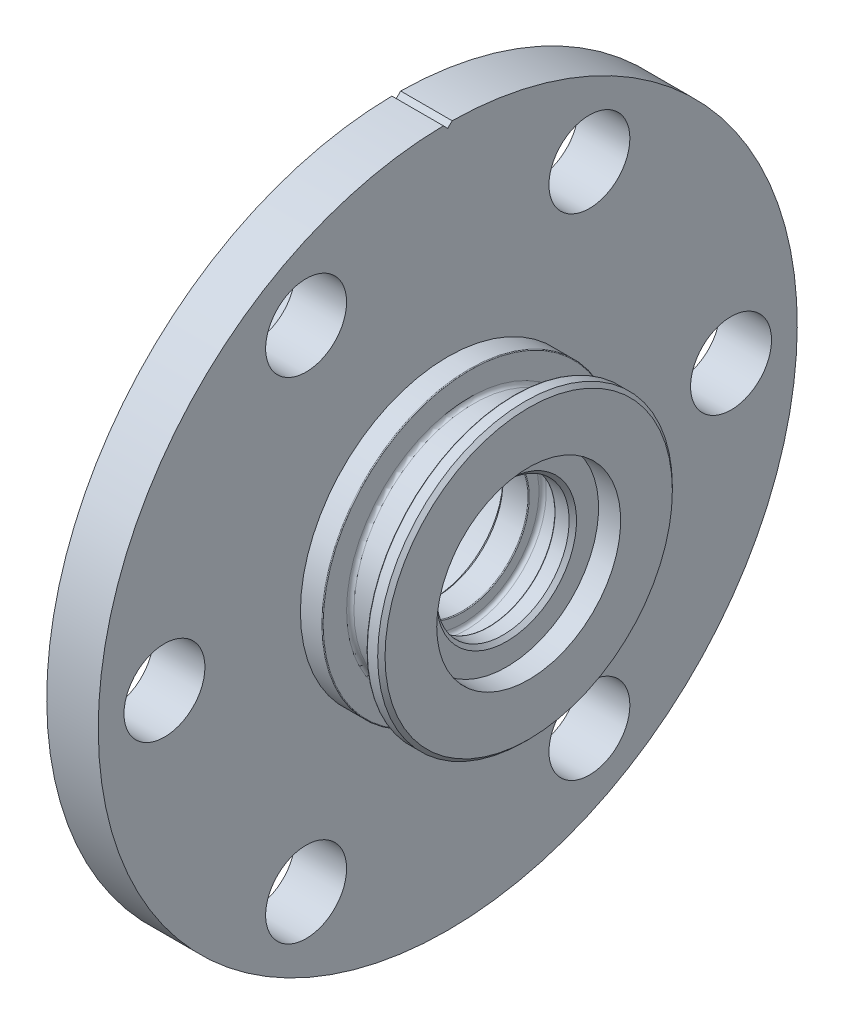
from build123d import *

# Parameters (mm, degrees)
SKETCH_2_R               = 5.5
CUT_EXTRUDE_1_DEPTH      = 70.810457669
PATTERN_CIRCULAR_1_COUNT = 6
CUT_EXTRUDE_2_DEPTH      = 70.810457669
CUT_EXTRUDE_3_DEPTH      = 4
CUT_EXTRUDE_4_DEPTH      = 3
CUT_EXTRUDE_5_DEPTH      = 0.5
CUT_EXTRUDE_6_DEPTH      = 0.5


with BuildPart() as part:
    # Эскиз1 → Повернуть1 (revolve)
    with BuildSketch(Plane.XY):
        with BuildLine():
            Line((0, 15), (17, 15))
            Line((17, 15), (17, 9.5))
            Line((17, 9.5), (17.5, 9))
            Line((17.5, 9), (20.9, 9))
            ThreePointArc((20.9, 9), (20.970710678, 9.029289322), (21, 9.1))
            Line((21, 9.1), (21, 10.4))
            ThreePointArc((21, 10.4), (21.146446609, 10.753553391), (21.5, 10.9))
            Line((21.5, 10.9), (24, 10.9))
            ThreePointArc((24, 10.9), (24.353553391, 10.753553391), (24.5, 10.4))
            Line((24.5, 10.4), (24.5, 9.1))
            ThreePointArc((24.5, 9.1), (24.529289322, 9.029289322), (24.6, 9))
            Line((24.6, 9), (26.5, 9))
            Line((26.5, 9), (27, 9.5))
            Line((27, 9.5), (27, 12.5))
            Line((27, 12.5), (30, 12.5))
            Line((30, 12.5), (30, 19.525))
            Line((30, 19.525), (29.5, 20.025))
            Line((29.5, 20.025), (28.1, 20.025))
            ThreePointArc((28.1, 20.025), (28.029289322, 19.995710678), (28, 19.925))
            Line((28, 19.925), (28, 16.75))
            ThreePointArc((28, 16.75), (27.853553391, 16.396446609), (27.5, 16.25))
            Line((27.5, 16.25), (22.5, 16.25))
            ThreePointArc((22.5, 16.25), (22.146446609, 16.396446609), (22, 16.75))
            Line((22, 16.75), (22, 19.925))
            ThreePointArc((22, 19.925), (21.970710678, 19.995710678), (21.9, 20.025))
            Line((21.9, 20.025), (19, 20.025))
            Line((19, 20.025), (19, 47.5))
            Line((19, 47.5), (12, 47.5))
            Line((12, 47.5), (12, 25))
            Line((12, 25), (0, 25))
            Line((0, 25), (0, 15))
        make_face()
    revolve(axis=Axis((0, 0, 0), (1, 0, 0)))

    # Эскиз2 → Вырез-Вытянуть1 (cut, through all)
    with BuildSketch(Plane(origin=(19, 0, 0), x_dir=(0, 0, -1), z_dir=(1, 0, 0))):
        with Locations((38.5, 0)):
            Circle(SKETCH_2_R)
    cut_extrude_1 = extrude(amount=-CUT_EXTRUDE_1_DEPTH, mode=Mode.SUBTRACT)

    # Круговой массив1: Вырез-Вытянуть1 ×6 about axis
    pattern_circular_1_axis = Axis((0, 0, 0), (-1, 0, 0))
    for i in range(1, PATTERN_CIRCULAR_1_COUNT):
        add(cut_extrude_1.rotate(pattern_circular_1_axis, i * 360 / PATTERN_CIRCULAR_1_COUNT), mode=Mode.SUBTRACT)

    # Эскиз3 → Вырез-Вытянуть2 (cut, through all)
    with BuildSketch(Plane(origin=(19, 0, 0), x_dir=(0, 0, -1), z_dir=(1, 0, 0))):
        with BuildLine():
            Line((-0.596257505, 47.496257505), (0, 46.9))
            Line((0, 46.9), (0.596257505, 47.496257505))
            ThreePointArc((0.596257505, 47.496257505), (0, 47.5), (-0.596257505, 47.496257505))
        make_face()
    extrude(amount=-CUT_EXTRUDE_2_DEPTH, mode=Mode.SUBTRACT)

    # Эскиз4 → Вырез-Вытянуть3 (cut)
    with BuildSketch(Plane.ZY):
        with BuildLine():
            Line((-22.449944321, -11), (-10.198039027, -11))
            ThreePointArc((-10.198039027, -11), (-12.990381057, 7.5), (4.427259928, 14.331760866))
            Line((4.427259928, 14.331760866), (-1.698692719, 24.942222095))
            ThreePointArc((-1.698692719, 24.942222095), (-21.650635095, 12.5), (-22.449944321, -11))
        make_face()
    extrude(amount=-CUT_EXTRUDE_3_DEPTH, mode=Mode.SUBTRACT)

    # Эскиз5 → Вырез-Вытянуть4 (cut)
    with BuildSketch(Plane.ZY.offset(-4)):
        with BuildLine():
            Line((-24.787849846, -3.25), (-14.643684646, -3.25))
            ThreePointArc((-14.643684646, -3.25), (-15, 0), (-14.643684646, 3.25))
            Line((-14.643684646, 3.25), (-24.787849846, 3.25))
            ThreePointArc((-24.787849846, 3.25), (-25, 0), (-24.787849846, -3.25))
        make_face()
        with BuildLine():
            Line((-15.208507485, 19.841907672), (-10.136424885, 11.056802908))
            ThreePointArc((-10.136424885, 11.056802908), (-7.5, 12.990381057), (-4.507259761, 14.306802908))
            Line((-4.507259761, 14.306802908), (-9.579342361, 23.091907672))
            ThreePointArc((-9.579342361, 23.091907672), (-12.5, 21.650635095), (-15.208507485, 19.841907672))
        make_face()
    extrude(amount=-CUT_EXTRUDE_4_DEPTH, mode=Mode.SUBTRACT)

    # Эскиз6 → Вырез-Вытянуть5 (cut)
    # profile 1 of 4: a face of its own
    with BuildSketch(Plane.ZY.offset(-12)):
        with BuildLine():
            Line((-0.180554406, 39.477018573), (0.357907132, 42.078180432))
            add(Edge.make_bspline(
                [(0.357907132, 42.078180432), (0.327144435, 42.055049142), (0.264132599, 42.007668867), (0.161224433, 41.943863239), (0.05006028, 41.882293935), (-0.070751591, 41.825598544), (-0.199878164, 41.770132642), (-0.338940831, 41.720698495), (-0.486111877, 41.672171644), (-0.588223671, 41.644849669), (-0.640490304, 41.630864726)],
                knots=[0, 0, 0, 0, 0.838359274, 1.717227777, 2.63582179, 3.606248445, 4.624055798, 5.697042507, 6.821215173, 8, 8, 8, 8], degree=3))
            Line((-0.640490304, 41.630864726), (-0.560562419, 41.989839085))
            add(Edge.make_bspline(
                [(-0.560562419, 41.989839085), (-0.507209173, 42.013756687), (-0.399270795, 42.06214413), (-0.241266586, 42.147063614), (-0.08349029, 42.240751127), (0.044089891, 42.327913735), (0.143742968, 42.399707853), (0.214231776, 42.451889885), (0.279749679, 42.502534023), (0.340126411, 42.551556729), (0.395379775, 42.599197515), (0.445871232, 42.644779087), (0.491867065, 42.68810806), (0.519756203, 42.717480305), (0.533187581, 42.731625944)],
                knots=[0, 0, 0, 0, 1.583313545, 3.203184633, 4.855583746, 6.551690609, 7.386215473, 8.182603945, 8.927160296, 9.629134756, 10.288998473, 10.903058912, 11.471714409, 12, 12, 12, 12], degree=3))
            add(Edge.make_bspline(
                [(0.533187581, 42.731625944), (0.54862987, 42.749182437), (0.580285751, 42.785172326), (0.623996935, 42.844365542), (0.667114487, 42.908431815), (0.69396942, 42.953740133), (0.707766908, 42.977018573)],
                knots=[0, 0, 0, 0, 0.929584414, 1.905599249, 2.923941894, 4, 4, 4, 4], degree=3))
            Line((0.707766908, 42.977018573), (0.949653927, 42.977018573))
            Line((0.949653927, 42.977018573), (0.230302966, 39.477018573))
            Line((0.230302966, 39.477018573), (-0.180554406, 39.477018573))
        make_face()
    # profile 2 of 4: a face of its own
    with BuildSketch(Plane.ZY.offset(-12)):
        with BuildLine():
            add(Edge.make_bspline(
                [(33.658708126, 20.6558349), (33.70781934, 20.671067075), (33.80244326, 20.700415322), (33.942982258, 20.731002115), (34.07527117, 20.751407215), (34.201975519, 20.759193075), (34.325829957, 20.756482967), (34.450405191, 20.742465624), (34.577434975, 20.720198397), (34.686367299, 20.69285953), (34.780722389, 20.663773108), (34.864852683, 20.636380514), (34.961567209, 20.603287896), (35.071075572, 20.564842528), (35.192886696, 20.51968141), (35.327331683, 20.469365122), (35.474353949, 20.413081675), (35.576304887, 20.373122717), (35.629561491, 20.352249163)],
                knots=[0, 0, 0, 0, 1.204779305, 2.321281203, 3.367971213, 4.339492292, 5.292959753, 6.268180703, 7.275121332, 8.31414202, 8.898160544, 9.589397699, 10.388039475, 11.294205731, 12.309856272, 13.43320494, 14.659170863, 16, 16, 16, 16], degree=3))
            add(Edge.make_bspline(
                [(35.629561491, 20.352249163), (35.661761364, 20.339493414), (35.723665541, 20.314970518), (35.813761481, 20.281774786), (35.896133543, 20.250400904), (35.971850624, 20.224145809), (36.040182159, 20.20055545), (36.101514827, 20.18121014), (36.155643291, 20.164714375), (36.189497352, 20.15583998), (36.205182485, 20.151728329)],
                knots=[0, 0, 0, 0, 1.362870858, 2.620115953, 3.77833347, 4.831281057, 5.773586764, 6.622888737, 7.361962113, 8, 8, 8, 8], degree=3))
            add(Edge.make_bspline(
                [(36.205182485, 20.151728329), (36.245486949, 20.142398003), (36.323263041, 20.124393142), (36.438228858, 20.10933454), (36.546162786, 20.10259052), (36.615578372, 20.106890191), (36.648992581, 20.1089599)],
                knots=[0, 0, 0, 0, 1.107911723, 2.137952887, 3.103676364, 4, 4, 4, 4], degree=3))
            add(Edge.make_bspline(
                [(36.648992581, 20.1089599), (36.671079966, 20.111890814), (36.715350813, 20.117765392), (36.779870162, 20.137045291), (36.843957367, 20.161117958), (36.884339566, 20.183234895), (36.904902036, 20.194496759)],
                knots=[0, 0, 0, 0, 0.982488777, 1.969251264, 2.965950105, 4, 4, 4, 4], degree=3))
            add(Edge.make_bspline(
                [(36.904902036, 20.194496759), (36.921735941, 20.204661743), (36.954834259, 20.224647828), (36.99979837, 20.260353596), (37.041103649, 20.298705349), (37.07621987, 20.341877457), (37.108733234, 20.386920884), (37.1352222, 20.436298417), (37.15683223, 20.489285068), (37.174483505, 20.544773791), (37.185886039, 20.601957436), (37.193484681, 20.659098713), (37.194207645, 20.71606109), (37.188108549, 20.77231293), (37.178045578, 20.828168698), (37.160737988, 20.882971738), (37.138286262, 20.937461246), (37.119307678, 20.972435148), (37.1096296, 20.990269996)],
                knots=[0, 0, 0, 0, 1.029422278, 2.024019106, 3.002884985, 3.976604764, 4.934720418, 5.910132956, 6.903975558, 7.930406914, 8.955961227, 9.955446647, 10.947476769, 11.932071302, 12.916818143, 13.916228535, 14.937386339, 16, 16, 16, 16], degree=3))
            add(Edge.make_bspline(
                [(37.1096296, 20.990269996), (37.099258991, 21.007585275), (37.078789479, 21.041762181), (37.041774911, 21.088124327), (37.001426387, 21.130020511), (36.959096922, 21.169706288), (36.910604159, 21.201808729), (36.860157682, 21.231772525), (36.805809736, 21.257263669), (36.747471835, 21.277315328), (36.685664583, 21.293159702), (36.619805051, 21.301878929), (36.55015746, 21.30548299), (36.476499016, 21.302493311), (36.399036321, 21.292936928), (36.317504887, 21.278253712), (36.232125034, 21.257098872), (36.174481313, 21.239228575), (36.14488601, 21.23005365)],
                knots=[0, 0, 0, 0, 0.890791895, 1.7582455, 2.61263812, 3.46058193, 4.313975991, 5.174521437, 6.052053172, 6.959735025, 7.89619894, 8.865656837, 9.889025904, 10.973821993, 12.117354432, 13.334393261, 14.63143049, 16, 16, 16, 16], degree=3))
            Line((36.14488601, 21.23005365), (35.987834728, 21.625486342))
            add(Edge.make_bspline(
                [(35.987834728, 21.625486342), (36.023377912, 21.63942523), (36.09309944, 21.66676776), (36.199330193, 21.696511893), (36.303792639, 21.717931387), (36.406527864, 21.730339642), (36.507985583, 21.731403691), (36.60748786, 21.723810365), (36.705718407, 21.707042489), (36.801368025, 21.680222967), (36.894132268, 21.645205344), (36.982655084, 21.601921046), (37.065716279, 21.549507597), (37.143823416, 21.489633923), (37.217501383, 21.421976991), (37.285105325, 21.345109974), (37.348750098, 21.260905178), (37.385911661, 21.200010463), (37.404801876, 21.169056054)],
                knots=[0, 0, 0, 0, 1.115855542, 2.188862788, 3.220910342, 4.232248558, 5.209649385, 6.183027772, 7.147052098, 8.118701484, 9.083379673, 10.04310653, 10.995014708, 11.950498094, 12.917787316, 13.91498675, 14.940132114, 16, 16, 16, 16], degree=3))
            add(Edge.make_bspline(
                [(37.404801876, 21.169056054), (37.427786379, 21.12630376), (37.472887094, 21.042414237), (37.522171415, 20.91024722), (37.553883536, 20.776429714), (37.569586568, 20.642495513), (37.567887374, 20.510617787), (37.54787882, 20.383741948), (37.507941205, 20.263618397), (37.450101935, 20.152206611), (37.379608582, 20.050322016), (37.298935448, 19.959891575), (37.209853823, 19.880579501), (37.142998173, 19.838831404), (37.1096296, 19.817994355)],
                knots=[0, 0, 0, 0, 1.127989899, 2.21336743, 3.269451819, 4.31995369, 5.342013454, 6.327707805, 7.295477983, 8.272773045, 9.237791438, 10.169519232, 11.086381901, 12, 12, 12, 12], degree=3))
            add(Edge.make_bspline(
                [(37.1096296, 19.817994355), (37.084399482, 19.804171889), (37.033876791, 19.776492739), (36.953372801, 19.743888494), (36.869977682, 19.717588936), (36.783206349, 19.699917522), (36.693769166, 19.687330493), (36.60088303, 19.683991325), (36.504760752, 19.68528067), (36.440018138, 19.692851549), (36.407105562, 19.696700284)],
                knots=[0, 0, 0, 0, 0.950163752, 1.902679592, 2.865321406, 3.836448888, 4.826229905, 5.846936954, 6.90546815, 8, 8, 8, 8], degree=3))
            add(Edge.make_bspline(
                [(36.407105562, 19.696700284), (36.395873699, 19.698492607), (36.371695697, 19.702350808), (36.333157753, 19.710277491), (36.289590333, 19.719967898), (36.241214034, 19.732702955), (36.188053967, 19.748352986), (36.129525039, 19.765796681), (36.066272916, 19.786174649), (35.997916154, 19.808517471), (35.925176328, 19.834049445), (35.847168322, 19.861115332), (35.764449991, 19.891721128), (35.676300273, 19.923459173), (35.583595885, 19.958742559), (35.486106708, 19.996886688), (35.383367174, 20.03648651), (35.313338862, 20.064045298), (35.27759835, 20.078110541)],
                knots=[0, 0, 0, 0, 0.457246047, 0.984279848, 1.581521093, 2.251567047, 2.995007651, 3.809514434, 4.706951792, 5.666714152, 6.700824875, 7.806324329, 8.986417404, 10.246789651, 11.573106774, 12.974297352, 14.455765103, 16, 16, 16, 16], degree=3))
            add(Edge.make_bspline(
                [(35.27759835, 20.078110541), (35.247004644, 20.090086269), (35.187551502, 20.113358855), (35.100608509, 20.146315664), (35.018568104, 20.176450836), (34.941581192, 20.203976877), (34.86957926, 20.227831399), (34.802319425, 20.248050978), (34.740580941, 20.26653598), (34.665876399, 20.285748047), (34.579258602, 20.304721248), (34.48090738, 20.322206939), (34.389008558, 20.33176024), (34.329934178, 20.332340027), (34.301636812, 20.332617752)],
                knots=[0, 0, 0, 0, 1.165771828, 2.265459344, 3.299162083, 4.266999938, 5.166485247, 5.990184484, 6.759087513, 7.453007125, 8.726665259, 9.904584845, 10.996269963, 12, 12, 12, 12], degree=3))
            Line((34.301636812, 20.332617752), (35.081985369, 18.981556054))
            Line((35.081985369, 18.981556054), (34.697770626, 18.856055252))
            Line((34.697770626, 18.856055252), (33.658708126, 20.6558349))
        make_face()
    # profile 3 of 4: a face of its own
    with BuildSketch(Plane.ZY.offset(-12)):
        with BuildLine():
            Line((-36.969019669, -20.099422896), (-36.713811335, -20.435260235))
            add(Edge.make_bspline(
                [(-36.713811335, -20.435260235), (-36.737143841, -20.453717847), (-36.782413341, -20.489529127), (-36.844958157, -20.54546256), (-36.899578254, -20.601810945), (-36.948054085, -20.657059859), (-36.98794823, -20.713129227), (-37.020354994, -20.768836515), (-37.046529998, -20.823899548), (-37.063597763, -20.87953353), (-37.075347174, -20.934914308), (-37.079922645, -20.990681664), (-37.079574753, -21.046629907), (-37.072114752, -21.102729203), (-37.059439698, -21.159048394), (-37.041058785, -21.215782548), (-37.017394953, -21.273051449), (-36.99697643, -21.309747152), (-36.986547713, -21.328489402)],
                knots=[0, 0, 0, 0, 1.369991066, 2.658043362, 3.860650297, 4.982569779, 6.039844813, 7.023792536, 7.948437492, 8.840301675, 9.697322654, 10.550957523, 11.412091524, 12.269180089, 13.15177349, 14.067416344, 15.012937116, 16, 16, 16, 16], degree=3))
            add(Edge.make_bspline(
                [(-36.986547713, -21.328489402), (-36.973008483, -21.350792493), (-36.946158399, -21.395022468), (-36.897781903, -21.454888498), (-36.846367679, -21.510304627), (-36.788466143, -21.55802604), (-36.727085393, -21.601010978), (-36.660292634, -21.637763538), (-36.588921211, -21.668527595), (-36.513454694, -21.69269042), (-36.436840704, -21.710848274), (-36.360777544, -21.721699502), (-36.286582555, -21.724112409), (-36.214213479, -21.72117743), (-36.143412888, -21.709777646), (-36.07468452, -21.690613603), (-36.007536573, -21.664879048), (-35.965258583, -21.642125172), (-35.943979604, -21.630672896)],
                knots=[0, 0, 0, 0, 1.041625132, 2.065680238, 3.06994913, 4.05779477, 5.057928611, 6.061328383, 7.098925301, 8.159352125, 9.224212466, 10.24267195, 11.224138038, 12.187344575, 13.133276971, 14.082753663, 15.035028809, 16, 16, 16, 16], degree=3))
            add(Edge.make_bspline(
                [(-35.943979604, -21.630672896), (-35.925956669, -21.619838539), (-35.890647438, -21.598612651), (-35.843032099, -21.560813255), (-35.799490773, -21.520810773), (-35.761811798, -21.476654884), (-35.72940445, -21.429278247), (-35.701578583, -21.378942196), (-35.67928544, -21.32508443), (-35.662548126, -21.268185278), (-35.651247093, -21.209499617), (-35.646349981, -21.149794192), (-35.647815346, -21.08940314), (-35.655607419, -21.028581453), (-35.669593863, -20.966926242), (-35.691325859, -20.905370112), (-35.71754521, -20.8423224), (-35.740231038, -20.801738726), (-35.751872233, -20.78091328)],
                knots=[0, 0, 0, 0, 1.029331314, 2.016591381, 2.972608994, 3.92277935, 4.853428351, 5.781043041, 6.735894067, 7.703296896, 8.682488308, 9.659132008, 10.632750058, 11.636932618, 12.659169198, 13.72381926, 14.831981622, 16, 16, 16, 16], degree=3))
            add(Edge.make_bspline(
                [(-35.751872233, -20.78091328), (-35.755591517, -20.774824341), (-35.764515348, -20.760214901), (-35.780910378, -20.734759243), (-35.802300771, -20.702034845), (-35.819093325, -20.678256893), (-35.828294508, -20.665228184)],
                knots=[0, 0, 0, 0, 0.617384292, 1.481315283, 2.619931199, 4, 4, 4, 4], degree=3))
            Line((-35.828294508, -20.665228184), (-35.48123922, -20.549543088))
            add(Edge.make_bspline(
                [(-35.48123922, -20.549543088), (-35.473352026, -20.56837862), (-35.457951102, -20.605157811), (-35.439203716, -20.64034761), (-35.430057329, -20.657515844)],
                knots=[0, 0, 0, 0, 1.024249383, 2, 2, 2, 2], degree=3))
            add(Edge.make_bspline(
                [(-35.430057329, -20.657515844), (-35.414801662, -20.683021081), (-35.385019885, -20.732811841), (-35.334787655, -20.801124244), (-35.283982823, -20.863593267), (-35.229820116, -20.917700431), (-35.173373871, -20.964262254), (-35.115173994, -21.003986563), (-35.054330966, -21.035605986), (-34.992134721, -21.060387055), (-34.928897413, -21.076835761), (-34.866262569, -21.087561168), (-34.804236352, -21.091998561), (-34.743046674, -21.089251093), (-34.682907328, -21.079163264), (-34.623785684, -21.062815083), (-34.565143894, -21.040763475), (-34.528193851, -21.020460434), (-34.509484412, -21.010180107)],
                knots=[0, 0, 0, 0, 1.287028092, 2.512507782, 3.670349145, 4.773073973, 5.823309793, 6.837229631, 7.820130982, 8.788580591, 9.731818402, 10.645791963, 11.538997133, 12.420937503, 13.29329128, 14.17523165, 15.07603919, 16, 16, 16, 16], degree=3))
            add(Edge.make_bspline(
                [(-34.509484412, -21.010180107), (-34.492644717, -21.00002244), (-34.459535014, -20.98005074), (-34.414778977, -20.944340429), (-34.373538509, -20.906736652), (-34.337931698, -20.864883764), (-34.305897341, -20.820672341), (-34.279137708, -20.772644407), (-34.257644133, -20.721216948), (-34.240110536, -20.667548192), (-34.227616901, -20.612650529), (-34.220140925, -20.557482836), (-34.219908034, -20.502950479), (-34.223878254, -20.448923744), (-34.233778207, -20.395569247), (-34.249369495, -20.342761664), (-34.270339374, -20.290520451), (-34.288518711, -20.257239909), (-34.29774563, -20.240348376)],
                knots=[0, 0, 0, 0, 1.059362376, 2.082886426, 3.081592175, 4.064427905, 5.040127438, 6.021831334, 7.021331915, 8.041592118, 9.062708146, 10.053751079, 11.036829174, 11.997601602, 12.971508916, 13.956523795, 14.962834013, 16, 16, 16, 16], degree=3))
            add(Edge.make_bspline(
                [(-34.29774563, -20.240348376), (-34.307749273, -20.224267097), (-34.327610626, -20.192339133), (-34.362292136, -20.147890148), (-34.400791458, -20.107269999), (-34.443041469, -20.070595773), (-34.489173178, -20.038144892), (-34.538994853, -20.009163511), (-34.593275136, -19.98501265), (-34.650484699, -19.963756281), (-34.710561838, -19.947721744), (-34.772748168, -19.937179819), (-34.836589665, -19.932101799), (-34.902287976, -19.933864005), (-34.969576592, -19.940855331), (-35.038433797, -19.95371177), (-35.109108201, -19.971792591), (-35.155806643, -19.98849365), (-35.179756848, -19.997059113)],
                knots=[0, 0, 0, 0, 0.909723662, 1.806176172, 2.703964625, 3.59576094, 4.490170531, 5.411058555, 6.361077004, 7.341805999, 8.341707468, 9.344380847, 10.369513512, 11.414332179, 12.498439584, 13.617589987, 14.778134637, 16, 16, 16, 16], degree=3))
            Line((-35.179756848, -19.997059113), (-35.31717672, -19.587603985))
            add(Edge.make_bspline(
                [(-35.31717672, -19.587603985), (-35.282264815, -19.577871218), (-35.213726206, -19.558763974), (-35.110344214, -19.541152751), (-35.009653532, -19.530361906), (-34.911148836, -19.527069389), (-34.814685912, -19.533545212), (-34.720467098, -19.548492488), (-34.628321153, -19.570609643), (-34.539395332, -19.601819146), (-34.453697639, -19.639568193), (-34.37212056, -19.684391152), (-34.295531065, -19.736766425), (-34.223130978, -19.79493122), (-34.155363827, -19.859739056), (-34.093102276, -19.931579263), (-34.034999157, -20.009776166), (-34.000959071, -20.065943187), (-33.983643066, -20.094515043)],
                knots=[0, 0, 0, 0, 1.122356113, 2.203395343, 3.244627065, 4.258866193, 5.253105233, 6.23532493, 7.211868866, 8.185185438, 9.151336723, 10.110733909, 11.064786832, 12.022707053, 12.985596141, 13.965891906, 14.96526033, 16, 16, 16, 16], degree=3))
            add(Edge.make_bspline(
                [(-33.983643066, -20.094515043), (-33.966742296, -20.125090592), (-33.9337263, -20.184820546), (-33.894266662, -20.277314554), (-33.864695189, -20.369613736), (-33.844056502, -20.461560727), (-33.833342999, -20.55321988), (-33.832876429, -20.644382299), (-33.841038664, -20.735134018), (-33.859494935, -20.824545752), (-33.886114964, -20.911038689), (-33.919524435, -20.993500213), (-33.961087052, -21.07043064), (-34.010668847, -21.141542525), (-34.067035742, -21.207749437), (-34.130400001, -21.269098362), (-34.20149694, -21.325011912), (-34.253685113, -21.356600456), (-34.280217585, -21.372660075)],
                knots=[0, 0, 0, 0, 1.140503879, 2.227997419, 3.278092693, 4.302260543, 5.301169828, 6.285891551, 7.274834943, 8.271846685, 9.26182061, 10.227150444, 11.173245211, 12.111268484, 13.0534753, 14.008976859, 14.98776361, 16, 16, 16, 16], degree=3))
            add(Edge.make_bspline(
                [(-34.280217585, -21.372660075), (-34.319628347, -21.393529527), (-34.396851199, -21.434421875), (-34.520097004, -21.473686783), (-34.644751697, -21.493071447), (-34.770718632, -21.49241527), (-34.898170476, -21.470659969), (-35.026046842, -21.428194018), (-35.15612017, -21.367510276), (-35.238576855, -21.31368657), (-35.281419508, -21.285720972)],
                knots=[0, 0, 0, 0, 1.0013532, 1.9620872, 2.892762958, 3.828338328, 4.782276689, 5.787869431, 6.850626311, 8, 8, 8, 8], degree=3))
            add(Edge.make_bspline(
                [(-35.281419508, -21.285720972), (-35.28273403, -21.32415222), (-35.285285093, -21.398734829), (-35.305923227, -21.506159105), (-35.335970683, -21.606107975), (-35.380299846, -21.697340582), (-35.435413283, -21.780838857), (-35.501894798, -21.856895186), (-35.581404234, -21.923857453), (-35.640849296, -21.961358562), (-35.671243226, -21.980532671)],
                knots=[0, 0, 0, 0, 1.100790148, 2.136277312, 3.125860573, 4.084759447, 5.032428424, 5.986634836, 6.970577585, 8, 8, 8, 8], degree=3))
            add(Edge.make_bspline(
                [(-35.671243226, -21.980532671), (-35.70502103, -21.998780767), (-35.771777946, -22.034845475), (-35.877026954, -22.075925901), (-35.983978872, -22.10676398), (-36.093414874, -22.124416497), (-36.204946807, -22.133005863), (-36.318596849, -22.127055405), (-36.434420678, -22.112043934), (-36.550131239, -22.084335899), (-36.664000942, -22.047950111), (-36.771764289, -22.000721434), (-36.87311537, -21.945568994), (-36.965836842, -21.879368478), (-37.052672524, -21.805725822), (-37.132355857, -21.722556641), (-37.204092517, -21.629662973), (-37.245395408, -21.562363624), (-37.26629531, -21.528309113)],
                knots=[0, 0, 0, 0, 1.000834344, 1.978003533, 2.941204094, 3.89952864, 4.86527348, 5.85399825, 6.862953875, 7.908643638, 8.953764356, 9.977807834, 10.973969053, 11.958548683, 12.944656505, 13.940873708, 14.958050262, 16, 16, 16, 16], degree=3))
            add(Edge.make_bspline(
                [(-37.26629531, -21.528309113), (-37.28487243, -21.494712294), (-37.321338494, -21.428763228), (-37.365031479, -21.326943484), (-37.40018171, -21.226389782), (-37.423991118, -21.126274078), (-37.438270136, -21.026992458), (-37.442461835, -20.928355858), (-37.437108058, -20.830324373), (-37.420633826, -20.733884945), (-37.39567211, -20.639834799), (-37.360940224, -20.549449571), (-37.317538877, -20.463209289), (-37.265145798, -20.381418291), (-37.204554535, -20.303755039), (-37.134633257, -20.230717103), (-37.056007852, -20.161732728), (-36.998369291, -20.120446097), (-36.969019669, -20.099422896)],
                knots=[0, 0, 0, 0, 1.132885491, 2.223803937, 3.266883664, 4.274436901, 5.257132668, 6.224075758, 7.184818927, 8.150209605, 9.107651284, 10.053409237, 11.003887975, 11.953339181, 12.916829068, 13.907631669, 14.934563605, 16, 16, 16, 16], degree=3))
        make_face()
    # profile 4 of 4: a face of its own
    with BuildSketch(Plane.ZY.offset(-12)):
        Polygon((37.274952168, -21.395575719), (36.598369636, -20.787703122), (35.887432136, -22.019574116), (35.564214989, -21.728608571), (34.660468995, -18.951465142), (34.836450566, -18.647178283), (36.523349604, -20.157394629), (36.768742232, -19.732514821), (37.059006655, -19.990527642), (36.814315149, -20.414706328), (37.490196559, -21.023280045), align=None)
        Polygon((36.308105213, -20.529690302), (35.201033899, -19.538304084), (35.811009861, -21.390667866), align=None, mode=Mode.SUBTRACT)
    extrude(amount=-CUT_EXTRUDE_5_DEPTH, mode=Mode.SUBTRACT)

    # Эскиз7 → Вырез-Вытянуть6 (cut)
    # profile 1 of 18: a face of its own
    with BuildSketch(Plane.ZY):
        Polygon((-11.11942423, -18.963913362), (-8.941038814, -16.167839644), (-6.494824871, -17.366056791), (-8.671106923, -20.163532753), (-9.087573269, -19.95950631), (-7.146868141, -17.48664974), (-8.761551634, -16.695784355), (-10.702957884, -19.167939804), align=None)
    # profile 2 of 18: a face of its own
    with BuildSketch(Plane.ZY):
        Polygon((-7.050291927, -20.825799013), (-5.418080389, -17.680566641), (-3.007623658, -18.353643564), (-3.192719812, -18.711916801), (-5.157263081, -18.163639557), (-5.666277504, -19.141704461), (-3.752215004, -19.675959269), (-3.938713401, -20.034232506), (-5.852775901, -19.499977698), (-6.417880068, -20.59442882), (-4.314514683, -21.181968884), (-4.500311959, -21.538138756), align=None)
    # profile 3 of 18: a face of its own
    with BuildSketch(Plane.ZY):
        with BuildLine():
            Line((-2.971815883, -21.783675944), (-1.996555466, -18.367109438))
            Line((-1.996555466, -18.367109438), (-0.548037838, -18.470875463))
            add(Edge.make_bspline(
                [(-0.548037838, -18.470875463), (-0.51762703, -18.47316031), (-0.458795672, -18.47758047), (-0.374028016, -18.488635801), (-0.295080818, -18.500075111), (-0.222219028, -18.514563586), (-0.155730674, -18.532405639), (-0.094802888, -18.550920154), (-0.040236515, -18.572629567), (0.024676569, -18.604292439), (0.09789746, -18.653724885), (0.176646029, -18.72626299), (0.244101731, -18.815250113), (0.302360421, -18.915885225), (0.348792094, -19.026694882), (0.378554047, -19.144817949), (0.39431161, -19.268124657), (0.391032517, -19.351684029), (0.389362002, -19.394252867)],
                knots=[0, 0, 0, 0, 0.972471492, 1.881298882, 2.725699301, 3.516552136, 4.248782947, 4.920669622, 5.546310103, 6.119680317, 7.221574463, 8.350294852, 9.519205374, 10.768286447, 12.051507461, 13.336913162, 14.643305852, 16, 16, 16, 16], degree=3))
            add(Edge.make_bspline(
                [(0.389362002, -19.394252867), (0.385635178, -19.430350022), (0.378143952, -19.502908311), (0.353558315, -19.611465064), (0.317609058, -19.719704047), (0.271768944, -19.82662182), (0.217837296, -19.927883277), (0.158939886, -20.021427329), (0.094566729, -20.104563561), (0.0246656, -20.176489378), (-0.046680616, -20.239698224), (-0.118819864, -20.293671372), (-0.190763094, -20.339007126), (-0.262742231, -20.376068102), (-0.336284879, -20.404453684), (-0.410235818, -20.429425961), (-0.486767887, -20.448352871), (-0.538630805, -20.457456466), (-0.564864761, -20.462061361)],
                knots=[0, 0, 0, 0, 1.125787643, 2.262926958, 3.446808514, 4.662412089, 5.869781847, 7.004952089, 8.090534854, 9.127052723, 10.1139867, 11.047019228, 11.92067287, 12.751333271, 13.55565765, 14.365558284, 15.17324607, 16, 16, 16, 16], degree=3))
            add(Edge.make_bspline(
                [(-0.564864761, -20.462061361), (-0.621343626, -20.470214153), (-0.733968638, -20.486471708), (-0.904221058, -20.498788326), (-1.074673957, -20.501080542), (-1.18817869, -20.495167338), (-1.244952902, -20.492209598)],
                knots=[0, 0, 0, 0, 1.003522009, 2.001132252, 3.000181426, 4, 4, 4, 4], degree=3))
            Line((-1.244952902, -20.492209598), (-2.113642806, -20.43051088))
            Line((-2.113642806, -20.43051088), (-2.507673255, -21.81732979))
            Line((-2.507673255, -21.81732979), (-2.971815883, -21.783675944))
        make_face()
        with BuildLine():
            Line((-2.002865562, -20.043491649), (-1.238642806, -20.098179149))
            add(Edge.make_bspline(
                [(-1.238642806, -20.098179149), (-1.202663216, -20.10052023), (-1.133317871, -20.105032318), (-1.032768561, -20.107728677), (-0.939423039, -20.107548669), (-0.853138738, -20.102286075), (-0.774006368, -20.094987863), (-0.701970043, -20.084142555), (-0.637421428, -20.068530484), (-0.561035012, -20.044674716), (-0.47423668, -20.004913612), (-0.380270375, -19.943049456), (-0.295091686, -19.868907755), (-0.221635548, -19.782218449), (-0.15995697, -19.687289427), (-0.112591401, -19.586725475), (-0.080541504, -19.481534469), (-0.072504227, -19.409414375), (-0.06847053, -19.373219213)],
                knots=[0, 0, 0, 0, 1.109878218, 2.139126373, 3.096051899, 3.98243506, 4.79928199, 5.542117789, 6.222694699, 6.84160838, 8.003907305, 9.147348152, 10.294562853, 11.468251706, 12.633708394, 13.769882881, 14.880763394, 16, 16, 16, 16], degree=3))
            add(Edge.make_bspline(
                [(-0.06847053, -19.373219213), (-0.067080684, -19.346105005), (-0.064415593, -19.294112327), (-0.071535937, -19.219119326), (-0.087126058, -19.151071953), (-0.113044652, -19.090544913), (-0.146080457, -19.036854235), (-0.186512394, -18.989608728), (-0.235244567, -18.950166858), (-0.281633758, -18.922020945), (-0.325470351, -18.903631083), (-0.365610983, -18.890539531), (-0.412390394, -18.878009553), (-0.466445613, -18.866734329), (-0.527552348, -18.857248195), (-0.59587022, -18.849023955), (-0.67090057, -18.841276708), (-0.723309091, -18.836993275), (-0.750662037, -18.834757675)],
                knots=[0, 0, 0, 0, 1.289180448, 2.472059797, 3.568794165, 4.594341745, 5.587110251, 6.555968276, 7.534649805, 8.555915834, 9.123391928, 9.790911697, 10.561670445, 11.424532156, 12.414499303, 13.500375768, 14.695401373, 16, 16, 16, 16], degree=3))
            Line((-0.750662037, -18.834757675), (-1.640385594, -18.770955592))
            Line((-1.640385594, -18.770955592), (-2.002865562, -20.043491649))
        make_face(mode=Mode.SUBTRACT)
    # profile 4 of 18: a face of its own
    with BuildSketch(Plane.ZY):
        Polygon((1.232262221, -21.947766477), (1.493079529, -18.414813752), (3.973648439, -18.083884265), (3.943500202, -18.486328175), (1.922867189, -18.755558944), (1.840835939, -19.854917919), (3.809585939, -19.591997246), (3.779437702, -19.995142278), (1.80998658, -20.258062951), (1.721645234, -21.486428335), (3.885307093, -21.197566156), (3.855158856, -21.597906701), align=None)
    # profile 5 of 18: a face of its own
    with BuildSketch(Plane.ZY):
        Polygon((5.371948313, -21.31803197), (4.977216742, -17.781573637), (7.574872992, -16.927607291), (7.971707928, -20.463364502), (7.529300076, -20.608496714), (7.190658249, -17.471677803), (5.475714338, -18.035379727), (5.814356165, -21.172198637), align=None)
    # profile 6 of 18: a face of its own
    with BuildSketch(Plane.ZY):
        with BuildLine():
            Line((8.186249666, -16.61133384), (8.591498063, -16.386273744))
            Line((8.591498063, -16.386273744), (10.354819377, -17.902099065))
            Line((10.354819377, -17.902099065), (10.44947082, -15.352119097))
            Line((10.44947082, -15.352119097), (10.877856236, -15.113737687))
            Line((10.877856236, -15.113737687), (10.706782518, -18.563958039))
            add(Edge.make_bspline(
                [(10.706782518, -18.563958039), (10.703460838, -18.6161356), (10.697127026, -18.715628282), (10.677903955, -18.856997897), (10.653426162, -18.983804282), (10.621072246, -19.09665897), (10.577896918, -19.196897239), (10.518324503, -19.283547385), (10.443417222, -19.358033834), (10.383237413, -19.394979776), (10.352716012, -19.413717654)],
                knots=[0, 0, 0, 0, 1.300208268, 2.479249837, 3.546432931, 4.510344366, 5.395186744, 6.248231421, 7.111555302, 8, 8, 8, 8], degree=3))
            add(Edge.make_bspline(
                [(10.352716012, -19.413717654), (10.344113067, -19.418477728), (10.325264614, -19.428906719), (10.293578977, -19.443853415), (10.257336937, -19.461597447), (10.215430427, -19.480627581), (10.168073653, -19.501326156), (10.115649617, -19.524597682), (10.057957332, -19.549231675), (10.017604564, -19.565687131), (9.99654614, -19.574274545)],
                knots=[0, 0, 0, 0, 0.603587471, 1.322418193, 2.150423646, 3.081568715, 4.148172534, 5.324063268, 6.603540458, 8, 8, 8, 8], degree=3))
            Line((9.99654614, -19.574274545), (9.878056557, -19.624054193))
            Line((9.878056557, -19.624054193), (9.756762486, -19.235632719))
            add(Edge.make_bspline(
                [(9.756762486, -19.235632719), (9.782937941, -19.226051385), (9.832026362, -19.208082928), (9.900761749, -19.182911725), (9.959791688, -19.160909903), (10.00957457, -19.143087926), (10.049613063, -19.127449832), (10.080182536, -19.115463346), (10.101604855, -19.107655907), (10.112023997, -19.102244545), (10.115736845, -19.100316212)],
                knots=[0, 0, 0, 0, 1.743412875, 3.269528225, 4.578348618, 5.683592724, 6.576698929, 7.266206627, 7.738513603, 8, 8, 8, 8], degree=3))
            add(Edge.make_bspline(
                [(10.115736845, -19.100316212), (10.129522712, -19.091296568), (10.157902661, -19.072728491), (10.193363339, -19.032149123), (10.223899276, -18.982004633), (10.249683951, -18.921709895), (10.270331469, -18.851508742), (10.28706033, -18.771344369), (10.298632624, -18.680603375), (10.30283111, -18.616572092), (10.30503973, -18.582888328)],
                knots=[0, 0, 0, 0, 0.689000354, 1.418394253, 2.238047845, 3.147738346, 4.162836802, 5.30602547, 6.582830145, 8, 8, 8, 8], degree=3))
            Line((10.30503973, -18.582888328), (10.311349826, -18.444066212))
            Line((10.311349826, -18.444066212), (8.186249666, -16.61133384))
        make_face()
    # profile 7 of 18: a face of its own
    with BuildSketch(Plane.ZY):
        with BuildLine():
            Line((14.363155874, -15.038648308), (14.756485201, -14.797462411))
            add(Edge.make_bspline(
                [(14.756485201, -14.797462411), (14.772930151, -14.846601487), (14.80524447, -14.943159743), (14.843438792, -15.088453307), (14.869734622, -15.231012251), (14.887365712, -15.37027933), (14.892784274, -15.5065217), (14.888059087, -15.639689883), (14.872576725, -15.769833415), (14.846884815, -15.896523363), (14.810488179, -16.018497547), (14.767631893, -16.136160026), (14.714382923, -16.247920989), (14.653646823, -16.355028921), (14.583026649, -16.455837858), (14.505037173, -16.551925824), (14.417761622, -16.642008216), (14.354005822, -16.697038924), (14.321789688, -16.724846225)],
                knots=[0, 0, 0, 0, 1.175495571, 2.309848146, 3.404954046, 4.462535234, 5.492096044, 6.494957171, 7.482833043, 8.462434611, 9.423886193, 10.368462165, 11.30064849, 12.229314296, 13.158933317, 14.089776466, 15.034754198, 16, 16, 16, 16], degree=3))
            add(Edge.make_bspline(
                [(14.321789688, -16.724846225), (14.28166925, -16.756673803), (14.203332578, -16.818818352), (14.079232757, -16.897519317), (13.953878084, -16.961776999), (13.8272467, -17.012231035), (13.698803583, -17.047349535), (13.569109172, -17.068813306), (13.437841979, -17.075051476), (13.30593416, -17.066542048), (13.174361181, -17.043503366), (13.044736802, -17.004633726), (12.917646312, -16.95002358), (12.793303871, -16.879867469), (12.670483143, -16.795304454), (12.551021152, -16.694388275), (12.433103848, -16.579037937), (12.359866162, -16.493373774), (12.322190329, -16.44930536)],
                knots=[0, 0, 0, 0, 1.072378221, 2.093859012, 3.072730479, 4.020187417, 4.944368558, 5.857221154, 6.769035708, 7.691451061, 8.621244716, 9.561589467, 10.520216132, 11.513252412, 12.548210832, 13.639702084, 14.785786464, 16, 16, 16, 16], degree=3))
            add(Edge.make_bspline(
                [(12.322190329, -16.44930536), (12.275096114, -16.389540189), (12.182636804, -16.272204195), (12.064202815, -16.08603578), (11.96438496, -15.897115274), (11.885509818, -15.704321129), (11.826697005, -15.507994004), (11.788445343, -15.30836051), (11.768121749, -15.105183169), (11.771974382, -14.969037736), (11.773913085, -14.900527315)],
                knots=[0, 0, 0, 0, 1.08457405, 2.129326709, 3.141596067, 4.128178458, 5.095159897, 6.059311141, 7.023416296, 8, 8, 8, 8], degree=3))
            add(Edge.make_bspline(
                [(11.773913085, -14.900527315), (11.778692758, -14.840293183), (11.788099232, -14.721751445), (11.824373171, -14.549002348), (11.87492596, -14.384175774), (11.943807094, -14.227973349), (12.028930046, -14.079959887), (12.131485219, -13.9405976), (12.25020399, -13.809216685), (12.340270629, -13.730866311), (12.385992412, -13.691092219)],
                knots=[0, 0, 0, 0, 1.036855333, 2.040547938, 3.024461411, 3.993233993, 4.96608099, 5.951172782, 6.959925274, 8, 8, 8, 8], degree=3))
            add(Edge.make_bspline(
                [(12.385992412, -13.691092219), (12.421175411, -13.663528909), (12.489938702, -13.609657892), (12.59671378, -13.538131841), (12.705404597, -13.479168143), (12.814433375, -13.430406468), (12.924603876, -13.393623497), (13.03546518, -13.368387072), (13.147167796, -13.353087273), (13.259236899, -13.350865041), (13.370373891, -13.358078887), (13.478957714, -13.377488156), (13.585152578, -13.405905524), (13.687626502, -13.446620749), (13.788000176, -13.49634088), (13.884714488, -13.557794211), (13.97869141, -13.629742727), (14.037336196, -13.684278045), (14.067282476, -13.712125872)],
                knots=[0, 0, 0, 0, 1.150981455, 2.249531767, 3.305481135, 4.332289363, 5.322137514, 6.291736316, 7.257159224, 8.220590831, 9.173984548, 10.121067297, 11.057124439, 12.000584711, 12.956256098, 13.938257595, 14.947195161, 16, 16, 16, 16], degree=3))
            Line((14.067282476, -13.712125872), (13.760892252, -14.017814975))
            add(Edge.make_bspline(
                [(13.760892252, -14.017814975), (13.736804342, -13.998368132), (13.689859568, -13.960468303), (13.617512178, -13.909708641), (13.545187642, -13.8665855), (13.472755165, -13.83164575), (13.401018184, -13.803021594), (13.329361174, -13.782610672), (13.257928575, -13.769922744), (13.18701302, -13.764250152), (13.116547637, -13.76562947), (13.046783985, -13.774092506), (12.97774557, -13.789639767), (12.909439109, -13.812232758), (12.841729307, -13.842044751), (12.774776533, -13.878535784), (12.708008741, -13.921364058), (12.666144713, -13.955011415), (12.644706355, -13.972242058)],
                knots=[0, 0, 0, 0, 1.205504255, 2.349399543, 3.439024516, 4.481194918, 5.478474544, 6.443710926, 7.37753487, 8.299752521, 9.210170435, 10.11789972, 11.032131871, 11.961865536, 12.915660716, 13.9094449, 14.929437217, 16, 16, 16, 16], degree=3))
            add(Edge.make_bspline(
                [(12.644706355, -13.972242058), (12.605941145, -14.006381866), (12.529810235, -14.07342896), (12.432516949, -14.188480915), (12.35153162, -14.311815907), (12.288970215, -14.444878576), (12.243136048, -14.586233503), (12.214414163, -14.736184026), (12.203043755, -14.894848134), (12.209040751, -15.002902134), (12.212114207, -15.058279719)],
                knots=[0, 0, 0, 0, 1.015445556, 1.994231293, 2.95483414, 3.911509117, 4.878739615, 5.871868202, 6.909334219, 8, 8, 8, 8], degree=3))
            add(Edge.make_bspline(
                [(12.212114207, -15.058279719), (12.217095715, -15.107250779), (12.227052769, -15.205134285), (12.257461184, -15.349643611), (12.297778604, -15.492227251), (12.351643939, -15.631661391), (12.416308875, -15.769119691), (12.493273598, -15.903890822), (12.581309978, -16.036920515), (12.648490352, -16.121199241), (12.682566931, -16.163948789)],
                knots=[0, 0, 0, 0, 0.967058991, 1.932960469, 2.898512235, 3.877189694, 4.867786214, 5.882133643, 6.925733285, 8, 8, 8, 8], degree=3))
            add(Edge.make_bspline(
                [(12.682566931, -16.163948789), (12.710701571, -16.196538446), (12.765405647, -16.259904713), (12.851512351, -16.346806875), (12.940104407, -16.421168033), (13.029619351, -16.484809739), (13.120011046, -16.538102807), (13.212373654, -16.578798609), (13.305829085, -16.608969441), (13.40029801, -16.626777667), (13.494566585, -16.634876858), (13.587598627, -16.631560696), (13.679182059, -16.620197138), (13.768689009, -16.597299522), (13.856275274, -16.56472039), (13.941982471, -16.522414463), (14.026073488, -16.470274092), (14.078868969, -16.429018311), (14.105844175, -16.407939174)],
                knots=[0, 0, 0, 0, 1.264712401, 2.459065543, 3.589625047, 4.658385541, 5.682936938, 6.666617818, 7.61772071, 8.561683854, 9.484841405, 10.391587904, 11.291785716, 12.191040364, 13.099137658, 14.032629715, 14.994796183, 16, 16, 16, 16], degree=3))
            add(Edge.make_bspline(
                [(14.105844175, -16.407939174), (14.128162079, -16.388684117), (14.172396137, -16.350520619), (14.232297193, -16.286912473), (14.285345889, -16.218804279), (14.333066628, -16.14688815), (14.373169213, -16.070170808), (14.409039896, -15.989999302), (14.436703469, -15.904792228), (14.458169214, -15.815925115), (14.474161084, -15.724415351), (14.480605229, -15.630509299), (14.480832937, -15.535368513), (14.473144611, -15.43847392), (14.456494091, -15.340435471), (14.433422322, -15.24059812), (14.402620239, -15.139335343), (14.376465464, -15.072605604), (14.363155874, -15.038648308)],
                knots=[0, 0, 0, 0, 0.944674143, 1.872343031, 2.795764885, 3.710265169, 4.635509567, 5.568339673, 6.523330353, 7.502964199, 8.498377825, 9.497844959, 10.516979822, 11.546912242, 12.610085025, 13.7025383, 14.830872279, 16, 16, 16, 16], degree=3))
        make_face()
    # profile 8 of 18: a face of its own
    with BuildSketch(Plane.ZY):
        with BuildLine():
            Line((14.116748501, -11.96057793), (14.407012924, -11.598097962))
            Line((14.407012924, -11.598097962), (15.39349129, -12.801924084))
            add(Edge.make_bspline(
                [(15.39349129, -12.801924084), (15.414003808, -12.775112459), (15.453157545, -12.723935159), (15.502792521, -12.645912375), (15.5406023, -12.570629436), (15.567183039, -12.495849154), (15.582431839, -12.416986277), (15.585680813, -12.330235933), (15.579639561, -12.233564128), (15.563734712, -12.126969826), (15.538233091, -12.010626574), (15.502720335, -11.885374936), (15.458454186, -11.750796618), (15.423124933, -11.659176893), (15.404709238, -11.611419276)],
                knots=[0, 0, 0, 0, 0.960573054, 1.833515729, 2.627818077, 3.353625226, 4.08550364, 4.904680638, 5.817566108, 6.839216018, 7.969127711, 9.205428069, 10.543303888, 12, 12, 12, 12], degree=3))
            add(Edge.make_bspline(
                [(15.404709238, -11.611419276), (15.389672488, -11.573355613), (15.36093713, -11.500615631), (15.321085488, -11.396103627), (15.285506452, -11.301476854), (15.256529535, -11.216149077), (15.231308865, -11.140624019), (15.212095137, -11.074574469), (15.196565038, -11.018215528), (15.184545659, -10.955852529), (15.17716894, -10.884319899), (15.179375482, -10.800471817), (15.191854995, -10.717476152), (15.215761421, -10.636330635), (15.246036067, -10.557951201), (15.283180961, -10.484041844), (15.323746727, -10.414054277), (15.356327394, -10.371747696), (15.372457636, -10.350802289)],
                knots=[0, 0, 0, 0, 1.462710487, 2.795252111, 3.997749551, 5.075499284, 6.015858407, 6.843132183, 7.534002742, 8.104083828, 9.111430193, 10.097389995, 11.094432892, 12.101813887, 13.114720497, 14.093435719, 15.056086192, 16, 16, 16, 16], degree=3))
            add(Edge.make_bspline(
                [(15.372457636, -10.350802289), (15.374291029, -10.348433639), (15.379466619, -10.341747042), (15.390951082, -10.330473387), (15.406329997, -10.312948175), (15.427551428, -10.291111922), (15.452202688, -10.262780448), (15.482948033, -10.230391338), (15.518610861, -10.192881098), (15.543583178, -10.165520907), (15.556852668, -10.150982577)],
                knots=[0, 0, 0, 0, 0.264147286, 0.745676323, 1.417224481, 2.321970672, 3.431972026, 4.730782629, 6.262842445, 8, 8, 8, 8], degree=3))
            Line((15.556852668, -10.150982577), (15.807153149, -10.453867193))
            add(Edge.make_bspline(
                [(15.807153149, -10.453867193), (15.79972902, -10.462098588), (15.780238413, -10.483708519), (15.759620845, -10.504250672), (15.746856674, -10.516968154)],
                knots=[0, 0, 0, 0, 0.761816054, 2, 2, 2, 2], degree=3))
            add(Edge.make_bspline(
                [(15.746856674, -10.516968154), (15.736307572, -10.527453441), (15.716966769, -10.546677243), (15.691263559, -10.573092168), (15.671429204, -10.593960217), (15.66081365, -10.606443475), (15.656411963, -10.611619596)],
                knots=[0, 0, 0, 0, 1.362858149, 2.49867422, 3.377482596, 4, 4, 4, 4], degree=3))
            add(Edge.make_bspline(
                [(15.656411963, -10.611619596), (15.644608405, -10.627753409), (15.621349125, -10.659545592), (15.600659085, -10.715579227), (15.589384776, -10.775239972), (15.591515897, -10.81630211), (15.592609879, -10.837380814)],
                knots=[0, 0, 0, 0, 0.992622678, 1.955994071, 2.950736644, 4, 4, 4, 4], degree=3))
            add(Edge.make_bspline(
                [(15.592609879, -10.837380814), (15.59385414, -10.849322606), (15.596476754, -10.874493143), (15.604024187, -10.914188262), (15.613406011, -10.958093471), (15.627522827, -11.005931108), (15.642594339, -11.05845204), (15.660644277, -11.11518505), (15.683023179, -11.175568406), (15.698265934, -11.21738204), (15.70619161, -11.239123603)],
                knots=[0, 0, 0, 0, 0.688076881, 1.450307092, 2.315054769, 3.261105624, 4.308395642, 5.448281032, 6.673199275, 8, 8, 8, 8], degree=3))
            add(Edge.make_bspline(
                [(15.70619161, -11.239123603), (15.722228315, -11.281604916), (15.753067446, -11.363297935), (15.795169008, -11.481798854), (15.831761252, -11.591465245), (15.863286576, -11.692450071), (15.890416975, -11.784546445), (15.910664368, -11.868422659), (15.926216124, -11.943234864), (15.940724928, -12.030587259), (15.946655917, -12.133398132), (15.93705924, -12.253134809), (15.909625427, -12.369700222), (15.878794948, -12.443089075), (15.863242892, -12.48010918)],
                knots=[0, 0, 0, 0, 1.269007391, 2.44034463, 3.514384794, 4.499785451, 5.396966543, 6.196969808, 6.910466557, 7.532201453, 8.670568906, 9.77818426, 10.87923236, 12, 12, 12, 12], degree=3))
            add(Edge.make_bspline(
                [(15.863242892, -12.48010918), (15.891805739, -12.465309905), (15.950711774, -12.434788907), (16.050730966, -12.407338208), (16.16104684, -12.390688421), (16.282631385, -12.385990767), (16.415356244, -12.3954775), (16.559328264, -12.416322307), (16.714960257, -12.448325721), (16.821155331, -12.478463584), (16.876363886, -12.494131616)],
                knots=[0, 0, 0, 0, 0.741369664, 1.528949388, 2.381073409, 3.315832803, 4.332875705, 5.450652245, 6.674648447, 8, 8, 8, 8], degree=3))
            Line((16.876363886, -12.494131616), (17.877565809, -12.794211744))
            Line((17.877565809, -12.794211744), (17.560658758, -13.190345558))
            Line((17.560658758, -13.190345558), (16.724220456, -12.940746199))
            add(Edge.make_bspline(
                [(16.724220456, -12.940746199), (16.684305444, -12.929124436), (16.607271617, -12.906695059), (16.495594555, -12.8771442), (16.392389603, -12.853561244), (16.298170905, -12.833592751), (16.212093426, -12.821717529), (16.134784672, -12.812465329), (16.06587443, -12.809431358), (16.004101469, -12.811919047), (15.947277315, -12.820637427), (15.89264321, -12.834633477), (15.83948459, -12.855288067), (15.786895941, -12.881077313), (15.736629644, -12.914810513), (15.686513623, -12.953196807), (15.638169484, -12.998480093), (15.607588854, -13.031690468), (15.591908758, -13.048718955)],
                knots=[0, 0, 0, 0, 1.633354422, 3.152286172, 4.537708864, 5.792857102, 6.934301791, 7.95034021, 8.850948635, 9.641474665, 10.375192237, 11.105685168, 11.852613678, 12.612301554, 13.401813713, 14.226478742, 15.09063403, 16, 16, 16, 16], degree=3))
            Line((15.591908758, -13.048718955), (16.64359145, -14.334576327))
            Line((16.64359145, -14.334576327), (16.353327027, -14.697757417))
            Line((16.353327027, -14.697757417), (14.116748501, -11.96057793))
        make_face()
    # profile 9 of 18: a face of its own
    with BuildSketch(Plane.ZY):
        Polygon((17.071183174, -7.155674675), (17.892897917, -5.081055284), (18.228735257, -5.302609771), (17.574588622, -6.955153842), (20.180658334, -8.686223553), (20.014492469, -9.10689663), align=None)
    # profile 10 of 18: a face of its own
    with BuildSketch(Plane.ZY):
        Polygon((17.918883105, -4.485365115), (18.008626695, -4.051370724), (20.509528137, -5.14371848), (18.373210028, -2.27262473), (18.461551375, -1.844940436), (21.716158746, -3.273125532), (21.6278174, -3.705016557), (19.145846246, -2.614772166), (21.263935189, -5.474647968), (21.173490477, -5.916354698), align=None)
    # profile 11 of 18: a face of its own
    with BuildSketch(Plane.ZY):
        with BuildLine():
            Line((18.465148472, -0.655647766), (18.508618023, 1.630009285))
            Line((18.508618023, 1.630009285), (21.572520267, 0.911359446))
            Line((21.572520267, 0.911359446), (21.578129241, 1.228266497))
            Line((21.578129241, 1.228266497), (22.657155683, 0.968150311))
            Line((22.657155683, 0.968150311), (22.649443343, 0.56149967))
            Line((22.649443343, 0.56149967), (21.961642863, 0.730470023))
            Line((21.961642863, 0.730470023), (21.914667702, -1.737478695))
            Line((21.914667702, -1.737478695), (22.602468183, -1.90715017))
            Line((22.602468183, -1.90715017), (22.594755843, -2.308892958))
            Line((22.594755843, -2.308892958), (21.515729401, -2.048776772))
            Line((21.515729401, -2.048776772), (21.521338376, -1.764822445))
            add(Edge.make_bspline(
                [(21.521338376, -1.764822445), (21.492265892, -1.738667403), (21.431663197, -1.684146224), (21.329240173, -1.607991808), (21.213115916, -1.533370587), (21.083902312, -1.45882762), (20.940357181, -1.386312048), (20.783471522, -1.314184232), (20.612566509, -1.243572461), (20.428361013, -1.17358217), (20.230324139, -1.104860682), (20.018547599, -1.037975914), (19.793229228, -0.97130849), (19.554369082, -0.905511738), (19.301691793, -0.840981311), (19.035103021, -0.778192167), (18.754875177, -0.715735102), (18.563124519, -0.675967328), (18.465148472, -0.655647766)],
                knots=[0, 0, 0, 0, 0.571630016, 1.191584439, 1.863681138, 2.58940594, 3.371970953, 4.214568958, 5.113925928, 6.075537754, 7.095841067, 8.178850712, 9.322937977, 10.53181014, 11.801689434, 13.136307926, 14.536780866, 16, 16, 16, 16], degree=3))
        make_face()
        with BuildLine():
            add(Edge.make_bspline(
                [(18.867592382, -0.277743119), (18.903628531, -0.285014989), (18.981565605, -0.300742204), (19.105770619, -0.330673552), (19.246315447, -0.36638609), (19.40264257, -0.40933154), (19.574981125, -0.459384456), (19.763705347, -0.515323434), (19.968386859, -0.578610605), (20.18426564, -0.647050548), (20.401111096, -0.718142098), (20.607215103, -0.793283627), (20.798270129, -0.868951941), (20.97458398, -0.945133563), (21.136007393, -1.022560076), (21.281894148, -1.101836009), (21.413198226, -1.181230335), (21.492915017, -1.238264981), (21.531154081, -1.265623727)],
                knots=[0, 0, 0, 0, 0.617725101, 1.335983112, 2.146580683, 3.054545993, 4.060098925, 5.162275082, 6.362285804, 7.660231217, 8.967978927, 10.196700473, 11.346055009, 12.420747263, 13.42372, 14.35336543, 15.210131737, 16, 16, 16, 16], degree=3))
            Line((21.531154081, -1.265623727), (21.563405683, 0.45212467))
            Line((21.563405683, 0.45212467), (18.893533888, 1.07331858))
            Line((18.893533888, 1.07331858), (18.867592382, -0.277743119))
        make_face(mode=Mode.SUBTRACT)
    # profile 12 of 18: a face of its own
    with BuildSketch(Plane.ZY):
        with BuildLine():
            Line((21.853749588, 2.37175495), (18.313785645, 2.434855912))
            Line((18.313785645, 2.434855912), (18.042451511, 3.856730912))
            add(Edge.make_bspline(
                [(18.042451511, 3.856730912), (18.03711742, 3.88661477), (18.026805675, 3.944385576), (18.014962407, 4.028802691), (18.006046432, 4.107805298), (18.002407917, 4.181765363), (17.999910961, 4.250342789), (18.00420289, 4.31373447), (18.009666795, 4.371981574), (18.024022718, 4.442538774), (18.051757155, 4.525896652), (18.102684253, 4.619715483), (18.17041242, 4.70779499), (18.2528443, 4.789844033), (18.347706283, 4.863278163), (18.454247069, 4.921967802), (18.568867358, 4.969061584), (18.650208279, 4.987401839), (18.691690293, 4.99675495)],
                knots=[0, 0, 0, 0, 0.970951887, 1.877022467, 2.726553972, 3.512808411, 4.245603265, 4.919475555, 5.543615967, 6.115415566, 7.219452978, 8.339971721, 9.513718397, 10.761282641, 12.051700368, 13.336953713, 14.641907146, 16, 16, 16, 16], degree=3))
            add(Edge.make_bspline(
                [(18.691690293, 4.99675495), (18.727366063, 5.002389265), (18.799336745, 5.013755676), (18.910080728, 5.01754542), (19.023329978, 5.010002536), (19.137565817, 4.993548291), (19.248986984, 4.967596486), (19.354587379, 4.935523912), (19.451089997, 4.89369897), (19.538833953, 4.84530495), (19.617334847, 4.791942033), (19.688375693, 4.737257116), (19.750303363, 4.679699684), (19.803903937, 4.619380543), (19.851574931, 4.557072137), (19.893459568, 4.491235925), (19.932501547, 4.422716375), (19.95453168, 4.374571808), (19.965628594, 4.350320655)],
                knots=[0, 0, 0, 0, 1.123694266, 2.266889852, 3.440613796, 4.653818769, 5.855822293, 6.999573479, 8.084921405, 9.123812403, 10.114684028, 11.037470045, 11.912671887, 12.742316987, 13.547084545, 14.352378224, 15.170067788, 16, 16, 16, 16], degree=3))
            add(Edge.make_bspline(
                [(19.965628594, 4.350320655), (19.987774172, 4.297985001), (20.031988927, 4.193494247), (20.086640233, 4.032623643), (20.134092331, 3.869564275), (20.156843523, 3.758754258), (20.168252793, 3.703185239)],
                knots=[0, 0, 0, 0, 1.003260831, 2.003060505, 2.998574559, 4, 4, 4, 4], degree=3))
            Line((20.168252793, 3.703185239), (20.330211927, 2.851322258))
            Line((20.330211927, 2.851322258), (21.767511607, 2.826782995))
            Line((21.767511607, 2.826782995), (21.853749588, 2.37175495))
        make_face()
        with BuildLine():
            Line((19.929170261, 2.858333476), (19.786141415, 3.608533796))
            add(Edge.make_bspline(
                [(19.786141415, 3.608533796), (19.778999953, 3.643608279), (19.765208169, 3.711345068), (19.743538898, 3.809231584), (19.71758445, 3.898647538), (19.692613528, 3.981011236), (19.663711774, 4.054688212), (19.636118662, 4.121821895), (19.604032175, 4.179860907), (19.56157624, 4.247198647), (19.501006751, 4.320179159), (19.418032216, 4.395312973), (19.324824466, 4.458496904), (19.222074781, 4.506643995), (19.114906223, 4.541753824), (19.005999561, 4.561743075), (18.896640736, 4.566143075), (18.825052391, 4.555485718), (18.789146222, 4.550140367)],
                knots=[0, 0, 0, 0, 1.106323483, 2.136561847, 3.096957092, 3.983281108, 4.794848454, 5.54219579, 6.224134252, 6.841255217, 8.000967689, 9.141286935, 10.29117355, 11.467168735, 12.636646813, 13.767202381, 14.880108102, 16, 16, 16, 16], degree=3))
            add(Edge.make_bspline(
                [(18.789146222, 4.550140367), (18.762548531, 4.544252922), (18.711804417, 4.533020625), (18.641550793, 4.506468609), (18.579636626, 4.474913766), (18.527988892, 4.434700651), (18.484261375, 4.389773441), (18.450575393, 4.337901464), (18.42317565, 4.28167763), (18.408936558, 4.229414126), (18.400990653, 4.182753864), (18.399873812, 4.140924638), (18.399318944, 4.092719124), (18.403709168, 4.038037758), (18.408738221, 3.976451501), (18.418389375, 3.908489706), (18.430188597, 3.834138023), (18.439855959, 3.782623291), (18.444895421, 3.755769373)],
                knots=[0, 0, 0, 0, 1.298145012, 2.476651767, 3.574027374, 4.599960307, 5.585843688, 6.550757243, 7.538341782, 8.558440669, 9.123071385, 9.792954345, 10.551207808, 11.422754286, 12.408069962, 13.499366823, 14.69645449, 16, 16, 16, 16], degree=3))
            Line((18.444895421, 3.755769373), (18.611061286, 2.882171617))
            Line((18.611061286, 2.882171617), (19.929170261, 2.858333476))
        make_face(mode=Mode.SUBTRACT)
    # profile 13 of 18: a face of its own
    with BuildSketch(Plane.ZY):
        Polygon((21.178225917, 5.984674377), (17.247036013, 6.610075018), (17.055629763, 7.121893928), (20.099900597, 8.869790562), (20.256951879, 8.449818607), (19.381250757, 7.943608671), (19.872036013, 6.631108671), (21.000842103, 6.460034953), align=None)
        with BuildLine():
            Line((19.468189859, 6.692106268), (19.067148193, 7.765523736))
            Line((19.067148193, 7.765523736), (18.300120949, 7.334333832))
            add(Edge.make_bspline(
                [(18.300120949, 7.334333832), (18.262733352, 7.313758898), (18.18970674, 7.273571302), (18.082428147, 7.214731844), (17.978477761, 7.161510163), (17.87995331, 7.109680772), (17.785190624, 7.063138181), (17.695208287, 7.019179493), (17.609294327, 6.979490976), (17.553218962, 6.954500402), (17.526082488, 6.942406748)],
                knots=[0, 0, 0, 0, 1.180085224, 2.304978975, 3.383142248, 4.409245223, 5.383228128, 6.302366709, 7.178466643, 8, 8, 8, 8], degree=3))
            add(Edge.make_bspline(
                [(17.526082488, 6.942406748), (17.582428644, 6.94049716), (17.701338743, 6.936467259), (17.888415918, 6.921102257), (18.093188313, 6.897817931), (18.235201037, 6.877353942), (18.309235533, 6.866685594)],
                knots=[0, 0, 0, 0, 0.859207319, 1.813228006, 2.859985532, 4, 4, 4, 4], degree=3))
            Line((18.309235533, 6.866685594), (19.468189859, 6.692106268))
        make_face(mode=Mode.SUBTRACT)
    # profile 14 of 18: a face of its own
    with BuildSketch(Plane.ZY):
        with BuildLine():
            Line((19.594992194, 9.964062463), (16.263962547, 8.786878969))
            Line((16.263962547, 8.786878969), (15.707271842, 9.701842911))
            add(Edge.make_bspline(
                [(15.707271842, 9.701842911), (15.683949524, 9.740998609), (15.640495369, 9.813953523), (15.582819276, 9.916835331), (15.537231733, 10.005068456), (15.513288511, 10.060003824), (15.502544278, 10.084655411)],
                knots=[0, 0, 0, 0, 1.258702917, 2.34521587, 3.257435484, 4, 4, 4, 4], degree=3))
            add(Edge.make_bspline(
                [(15.502544278, 10.084655411), (15.489170728, 10.120172338), (15.463222739, 10.189083951), (15.437822427, 10.293402982), (15.421595655, 10.393518847), (15.417180982, 10.490214186), (15.424279478, 10.584039636), (15.446346797, 10.674240482), (15.478056839, 10.762333388), (15.524734483, 10.845370338), (15.579997643, 10.924704881), (15.647157793, 10.996520413), (15.722607416, 11.062434086), (15.779452216, 11.098929683), (15.80823338, 11.117407815)],
                knots=[0, 0, 0, 0, 1.149851231, 2.230995497, 3.249344073, 4.221182648, 5.159898498, 6.091606002, 7.028902942, 7.989853608, 8.971052826, 9.954067495, 10.964121276, 12, 12, 12, 12], degree=3))
            add(Edge.make_bspline(
                [(15.80823338, 11.117407815), (15.828662313, 11.129111366), (15.868868419, 11.152145081), (15.930957751, 11.182010133), (15.993896952, 11.205702545), (16.057692515, 11.224076397), (16.121881483, 11.237532783), (16.1871121, 11.24509749), (16.252738531, 11.248096333), (16.319125935, 11.245207543), (16.385688388, 11.236666121), (16.45277441, 11.22298839), (16.519317921, 11.201313064), (16.586285647, 11.174812811), (16.652680385, 11.141642451), (16.719310367, 11.102705656), (16.785524548, 11.057353555), (16.828336878, 11.023260519), (16.850100367, 11.00592945)],
                knots=[0, 0, 0, 0, 1.003029579, 1.974058805, 2.93213354, 3.865035535, 4.800538292, 5.723232649, 6.660165394, 7.597098138, 8.550659623, 9.517441263, 10.509535604, 11.528456138, 12.583948086, 13.668495062, 14.814788098, 16, 16, 16, 16], degree=3))
            add(Edge.make_bspline(
                [(16.850100367, 11.00592945), (16.84479016, 11.029462367), (16.834391171, 11.075546921), (16.825928989, 11.144340866), (16.820422354, 11.210559189), (16.820796878, 11.27451727), (16.824339597, 11.336514753), (16.834717937, 11.396177177), (16.848295188, 11.453810055), (16.873777195, 11.526768819), (16.916701135, 11.612354656), (16.984090607, 11.705189825), (17.067067676, 11.787696517), (17.132743124, 11.830837535), (17.166306297, 11.852884578)],
                knots=[0, 0, 0, 0, 0.891136127, 1.745113517, 2.559369839, 3.345462634, 4.107405175, 4.851560577, 5.580672799, 6.293692645, 7.703761387, 9.101632097, 10.518800782, 12, 12, 12, 12], degree=3))
            add(Edge.make_bspline(
                [(17.166306297, 11.852884578), (17.186649487, 11.86499609), (17.227319974, 11.88920965), (17.292227077, 11.917816667), (17.358212103, 11.943593804), (17.426464902, 11.963924147), (17.496837159, 11.979070318), (17.568869374, 11.990763168), (17.643216401, 11.995824996), (17.743956897, 11.998061234), (17.869664521, 11.987757378), (18.016967122, 11.958009688), (18.158154428, 11.907566759), (18.292316105, 11.838479856), (18.41816762, 11.752272529), (18.532717382, 11.648556695), (18.638367402, 11.530602895), (18.696162708, 11.440795896), (18.725601169, 11.395052046)],
                knots=[0, 0, 0, 0, 0.629259873, 1.258028137, 1.883838636, 2.513282763, 3.149871221, 3.797923614, 4.452622264, 5.13041178, 6.477481039, 7.798004459, 9.117473685, 10.452147222, 11.802440768, 13.162929658, 14.554917501, 16, 16, 16, 16], degree=3))
            Line((18.725601169, 11.395052046), (19.594992194, 9.964062463))
        make_face()
        with BuildLine():
            Line((17.446755015, 9.684314867), (17.082171681, 10.283072879))
            add(Edge.make_bspline(
                [(17.082171681, 10.283072879), (17.060716241, 10.317375197), (17.019318303, 10.383560984), (16.954962398, 10.476317394), (16.890604356, 10.558734632), (16.825898805, 10.630377434), (16.762124182, 10.692723934), (16.698442284, 10.744773023), (16.635103152, 10.7870994), (16.571097511, 10.817942636), (16.507796119, 10.841088281), (16.443758998, 10.854301999), (16.379540485, 10.859909829), (16.314657952, 10.858236062), (16.249786338, 10.846354609), (16.184639984, 10.827253397), (16.119125601, 10.799942393), (16.077213873, 10.775745138), (16.055729374, 10.763341309)],
                knots=[0, 0, 0, 0, 1.506109393, 2.906014591, 4.201002311, 5.3961245, 6.497532928, 7.518028782, 8.454344701, 9.325969749, 10.157048186, 10.957361835, 11.752170415, 12.553051395, 13.365521927, 14.199736949, 15.077161643, 16, 16, 16, 16], degree=3))
            add(Edge.make_bspline(
                [(16.055729374, 10.763341309), (16.035912392, 10.750583001), (15.997427912, 10.725806432), (15.947867434, 10.680056619), (15.906587982, 10.62990966), (15.874322271, 10.575180153), (15.85132562, 10.517662499), (15.836516561, 10.458658611), (15.8330842, 10.398308374), (15.835719712, 10.346604241), (15.845485032, 10.3028292), (15.85659041, 10.264977517), (15.873335499, 10.222907944), (15.893397411, 10.175901039), (15.919031261, 10.124607073), (15.949337963, 10.068710979), (15.983478067, 10.007806256), (16.008414582, 9.966104162), (16.021374406, 9.944431052)],
                knots=[0, 0, 0, 0, 1.197144983, 2.324849526, 3.414882072, 4.491539479, 5.542483342, 6.557573418, 7.570711931, 8.607572158, 9.178896295, 9.848529832, 10.612529285, 11.480558238, 12.448309057, 13.528178515, 14.715362927, 16, 16, 16, 16], degree=3))
            Line((16.021374406, 9.944431052), (16.403485784, 9.315524802))
            Line((16.403485784, 9.315524802), (17.446755015, 9.684314867))
        make_face(mode=Mode.SUBTRACT)
        with BuildLine():
            Line((18.978005015, 10.226282014), (18.568549887, 10.899358937))
            add(Edge.make_bspline(
                [(18.568549887, 10.899358937), (18.555594337, 10.920942348), (18.530792892, 10.962260534), (18.493201402, 11.020126788), (18.45988099, 11.072840055), (18.429006322, 11.119513944), (18.400088187, 11.159737363), (18.375071277, 11.195309237), (18.352198327, 11.224414275), (18.337464365, 11.241549269), (18.330869598, 11.249218713)],
                knots=[0, 0, 0, 0, 1.426816529, 2.731425099, 3.911061991, 4.961894486, 5.902851367, 6.719061983, 7.426665566, 8, 8, 8, 8], degree=3))
            add(Edge.make_bspline(
                [(18.330869598, 11.249218713), (18.307070828, 11.275661156), (18.261326464, 11.326487006), (18.187052198, 11.39195755), (18.112942133, 11.445943804), (18.037359802, 11.487202656), (17.960951059, 11.51799624), (17.882356269, 11.537616108), (17.801594298, 11.547506826), (17.719423477, 11.547439846), (17.637804355, 11.537582689), (17.558745931, 11.518936434), (17.483566481, 11.489741903), (17.436678134, 11.464056989), (17.413101169, 11.45114179)],
                knots=[0, 0, 0, 0, 1.242669294, 2.38857367, 3.45413814, 4.441277507, 5.390958907, 6.326193488, 7.264527299, 8.228542875, 9.19120744, 10.132417567, 11.060919632, 12, 12, 12, 12], degree=3))
            add(Edge.make_bspline(
                [(17.413101169, 11.45114179), (17.396574781, 11.440401885), (17.364558805, 11.419595853), (17.320461373, 11.385126577), (17.282555217, 11.347820911), (17.249910768, 11.308455218), (17.223240772, 11.266606439), (17.200979446, 11.223212818), (17.185695153, 11.177049379), (17.175555544, 11.128404999), (17.171784719, 11.075747394), (17.177468922, 11.01849667), (17.19046068, 10.956329295), (17.211187411, 10.888885108), (17.23953122, 10.815902896), (17.275459347, 10.737549614), (17.318908851, 10.653822224), (17.352711466, 10.597690741), (17.370332739, 10.56842945)],
                knots=[0, 0, 0, 0, 0.930759643, 1.803127206, 2.638385954, 3.438396378, 4.21310146, 4.978310309, 5.735836464, 6.502238777, 7.320994049, 8.21849314, 9.210046823, 10.317097527, 11.547151419, 12.90567733, 14.386932401, 16, 16, 16, 16], degree=3))
            Line((17.370332739, 10.56842945), (17.825360784, 9.818930251))
            Line((17.825360784, 9.818930251), (18.978005015, 10.226282014))
        make_face(mode=Mode.SUBTRACT)
    # profile 15 of 18: a face of its own
    with BuildSketch(Plane.ZY):
        with BuildLine():
            Line((14.207127417, 11.799077201), (12.702520045, 13.506308772))
            Line((12.702520045, 13.506308772), (15.796570526, 15.241585214))
            Line((15.796570526, 15.241585214), (16.105064116, 14.891725438))
            Line((16.105064116, 14.891725438), (13.359471167, 13.358372073))
            Line((13.359471167, 13.358372073), (14.256907064, 12.341044348))
            Line((14.256907064, 12.341044348), (15.955725173, 13.290363259))
            add(Edge.make_bspline(
                [(15.955725173, 13.290363259), (16.009125457, 13.319791927), (16.111593393, 13.376261567), (16.260532305, 13.453891827), (16.398740476, 13.518562011), (16.524159642, 13.574329102), (16.638676038, 13.617291176), (16.741617105, 13.649309084), (16.832975861, 13.670338601), (16.914590115, 13.680506516), (16.990304582, 13.678971981), (17.06340923, 13.667737895), (17.135527728, 13.646434837), (17.206565293, 13.614929693), (17.276581911, 13.573389467), (17.345500651, 13.521499104), (17.41385329, 13.460336157), (17.456515206, 13.413912846), (17.478561712, 13.389922554)],
                knots=[0, 0, 0, 0, 1.724061912, 3.308242045, 4.747844103, 6.038149961, 7.188254664, 8.204167291, 9.084358021, 9.836017807, 10.5234049, 11.218750613, 11.921343611, 12.643310279, 13.410581303, 14.218116155, 15.079171382, 16, 16, 16, 16], degree=3))
            add(Edge.make_bspline(
                [(17.478561712, 13.389922554), (17.490936984, 13.375372096), (17.518404695, 13.343076422), (17.558562491, 13.285189928), (17.604690688, 13.21572624), (17.635815068, 13.164291212), (17.652439917, 13.136817586)],
                knots=[0, 0, 0, 0, 0.745148351, 1.653904663, 2.746851172, 4, 4, 4, 4], degree=3))
            Line((17.652439917, 13.136817586), (17.301177898, 12.936997874))
            add(Edge.make_bspline(
                [(17.301177898, 12.936997874), (17.293027458, 12.950804152), (17.277521312, 12.977070487), (17.255167362, 13.013905653), (17.23547382, 13.046496419), (17.218072458, 13.074245125), (17.20319514, 13.097663694), (17.190913786, 13.11661341), (17.180247551, 13.13060897), (17.174048751, 13.138459865), (17.171470366, 13.141725438)],
                knots=[0, 0, 0, 0, 1.586579885, 3.018455827, 4.263930732, 5.354871045, 6.259523358, 7.010022445, 7.588219654, 8, 8, 8, 8], degree=3))
            add(Edge.make_bspline(
                [(17.171470366, 13.141725438), (17.154757353, 13.158029823), (17.121319455, 13.190650176), (17.054437201, 13.220435488), (16.977794909, 13.233064601), (16.906670139, 13.22994769), (16.842511106, 13.219227763), (16.78523944, 13.203006721), (16.720517765, 13.180498055), (16.647813577, 13.151367267), (16.567392517, 13.115539204), (16.479202264, 13.072820479), (16.383746037, 13.022513201), (16.317695796, 12.986620472), (16.283149052, 12.967847233)],
                knots=[0, 0, 0, 0, 0.861829938, 1.724272126, 2.667960076, 3.727937451, 4.353222207, 5.082081944, 5.936133434, 6.898807789, 7.991226277, 9.206847454, 10.539076858, 12, 12, 12, 12], degree=3))
            Line((16.283149052, 12.967847233), (14.207127417, 11.799077201))
        make_face()
    # profile 16 of 18: a face of its own
    with BuildSketch(Plane.ZY):
        Polygon((12.007171395, 14.014114831), (11.654507133, 14.285448966), (13.738942229, 16.06068935), (10.210897357, 15.397428132), (9.86454319, 15.663854415), (12.584194633, 17.97054512), (12.93475553, 17.700613229), (10.860136139, 15.942199767), (14.370652966, 16.594944158), (14.728225081, 16.319403293), align=None)
    # profile 17 of 18: a face of its own
    with BuildSketch(Plane.ZY):
        with BuildLine():
            Line((9.058877306, 16.127865043), (8.649422178, 16.34941953))
            Line((8.649422178, 16.34941953), (9.66184205, 17.540625459))
            add(Edge.make_bspline(
                [(9.66184205, 17.540625459), (9.631672033, 17.556013803), (9.574127781, 17.585364489), (9.488208729, 17.62074139), (9.406643617, 17.643042191), (9.328153379, 17.656294353), (9.247772256, 17.656704981), (9.161792666, 17.644430586), (9.067262881, 17.621910222), (8.965361823, 17.585798201), (8.855015236, 17.540180868), (8.737385725, 17.48308697), (8.612515137, 17.414729856), (8.527943141, 17.363792529), (8.483957435, 17.337300139)],
                knots=[0, 0, 0, 0, 0.960655065, 1.832288512, 2.630069121, 3.354901615, 4.08420768, 4.899967166, 5.813338335, 6.8364749, 7.963030605, 9.199533674, 10.543483697, 12, 12, 12, 12], degree=3))
            add(Edge.make_bspline(
                [(8.483957435, 17.337300139), (8.449160543, 17.315758569), (8.382534111, 17.274512415), (8.286742072, 17.216097092), (8.198980801, 17.165273414), (8.12046635, 17.119767461), (8.049975429, 17.082088374), (7.988104176, 17.051328352), (7.935463022, 17.025975866), (7.876381971, 17.002970397), (7.807138329, 16.982760678), (7.724157007, 16.970563662), (7.639606977, 16.967099885), (7.555097995, 16.97646828), (7.472115491, 16.992361499), (7.392399444, 17.014983782), (7.31650593, 17.043404516), (7.268720981, 17.067409009), (7.245075223, 17.079287318)],
                knots=[0, 0, 0, 0, 1.458203196, 2.79205617, 3.997452961, 5.071623463, 6.025327938, 6.844611497, 7.533806067, 8.105960888, 9.102230921, 10.096201465, 11.087692361, 12.108507623, 13.117777843, 14.095748736, 15.057706159, 16, 16, 16, 16], degree=3))
            add(Edge.make_bspline(
                [(7.245075223, 17.079287318), (7.242512459, 17.080936266), (7.235365285, 17.085534939), (7.221424082, 17.093699876), (7.20135953, 17.105772402), (7.1759657, 17.122629598), (7.144238648, 17.143051835), (7.106189379, 17.166826667), (7.062163989, 17.194735446), (7.03097659, 17.215035815), (7.014406153, 17.225821774)],
                knots=[0, 0, 0, 0, 0.267596426, 0.746287466, 1.418576008, 2.323715787, 3.422453272, 4.7321168, 6.263713625, 8, 8, 8, 8], degree=3))
            Line((7.014406153, 17.225821774), (7.268212242, 17.527304145))
            add(Edge.make_bspline(
                [(7.268212242, 17.527304145), (7.278073512, 17.521298383), (7.303327448, 17.505918099), (7.327684904, 17.489148235), (7.342531153, 17.478926742)],
                knots=[0, 0, 0, 0, 0.780968932, 2, 2, 2, 2], degree=3))
            add(Edge.make_bspline(
                [(7.342531153, 17.478926742), (7.354627935, 17.470198616), (7.376555515, 17.454377327), (7.406904285, 17.434095006), (7.430618783, 17.418456379), (7.444636416, 17.410176841), (7.450503909, 17.406711197)],
                knots=[0, 0, 0, 0, 1.377384535, 2.496755757, 3.37077284, 4, 4, 4, 4], degree=3))
            add(Edge.make_bspline(
                [(7.450503909, 17.406711197), (7.468695373, 17.398246887), (7.504888696, 17.381406489), (7.563975479, 17.369548223), (7.625298771, 17.370346923), (7.665393722, 17.379534791), (7.686080832, 17.384275299)],
                knots=[0, 0, 0, 0, 0.989906869, 1.96949627, 2.95235552, 4, 4, 4, 4], degree=3))
            add(Edge.make_bspline(
                [(7.686080832, 17.384275299), (7.710338611, 17.391971916), (7.764936134, 17.409294864), (7.851039091, 17.45031627), (7.952774307, 17.502942287), (8.024008931, 17.545126182), (8.062583236, 17.567969209)],
                knots=[0, 0, 0, 0, 0.726482354, 1.635110024, 2.71938698, 4, 4, 4, 4], degree=3))
            add(Edge.make_bspline(
                [(8.062583236, 17.567969209), (8.101497678, 17.591534646), (8.176318053, 17.636843656), (8.286080481, 17.699086755), (8.387733334, 17.755205389), (8.481267055, 17.805387988), (8.568008431, 17.847491875), (8.646708908, 17.883242024), (8.717679974, 17.912407377), (8.801410109, 17.94144466), (8.901782531, 17.966215334), (9.021965929, 17.977427627), (9.142351578, 17.971603986), (9.220550568, 17.954050374), (9.260099262, 17.945172735)],
                knots=[0, 0, 0, 0, 1.266319201, 2.434738192, 3.512095938, 4.498653008, 5.388968469, 6.195504092, 6.904643131, 7.523905494, 8.661565423, 9.772403074, 10.873405537, 12, 12, 12, 12], degree=3))
            add(Edge.make_bspline(
                [(9.260099262, 17.945172735), (9.240253924, 17.970754675), (9.199347741, 18.023485425), (9.153843524, 18.11730612), (9.118156182, 18.223619542), (9.092851481, 18.343170517), (9.077047814, 18.475954451), (9.071156772, 18.621716709), (9.075464892, 18.78099659), (9.086217251, 18.891036632), (9.091830031, 18.948478024)],
                knots=[0, 0, 0, 0, 0.743177188, 1.531873318, 2.383725738, 3.319169938, 4.337533141, 5.456941004, 6.672511883, 8, 8, 8, 8], degree=3))
            Line((9.091830031, 18.948478024), (9.208917371, 19.991046133))
            Line((9.208917371, 19.991046133), (9.656233076, 19.749159113))
            Line((9.656233076, 19.749159113), (9.559478268, 18.878365844))
            add(Edge.make_bspline(
                [(9.559478268, 18.878365844), (9.555008647, 18.83679014), (9.546405972, 18.756769441), (9.538230995, 18.641233906), (9.533092479, 18.535103435), (9.531522364, 18.438520656), (9.533520689, 18.351275523), (9.538628696, 18.273258247), (9.548342714, 18.204610631), (9.561544418, 18.143906696), (9.580139291, 18.089334918), (9.604508708, 18.038299105), (9.633753581, 17.989219976), (9.669273421, 17.942444547), (9.710944522, 17.898405682), (9.757923109, 17.856219769), (9.811182693, 17.816676913), (9.849563015, 17.792756375), (9.869374101, 17.780409113)],
                knots=[0, 0, 0, 0, 1.637547032, 3.151784464, 4.535375103, 5.798624805, 6.933931668, 7.952552417, 8.858655381, 9.646932013, 10.382142498, 11.110943804, 11.858135449, 12.616014526, 13.406042827, 14.229255279, 15.085980107, 16, 16, 16, 16], degree=3))
            Line((9.869374101, 17.780409113), (10.951205031, 19.04873844))
            Line((10.951205031, 19.04873844), (11.361361281, 18.827183953))
            Line((11.361361281, 18.827183953), (9.058877306, 16.127865043))
        make_face()
    # profile 18 of 18: a face of its own
    with BuildSketch(Plane.ZY):
        Polygon((8.40795247, 20.337116906), (5.438000547, 17.649015945), (4.917067054, 17.821491906), (5.465344297, 21.310975079), (5.893729714, 21.169348477), (5.739482919, 20.163939823), (7.077924425, 19.720830848), (7.922776188, 20.497673797), align=None)
        with BuildLine():
            Line((6.77503981, 19.443186618), (5.680588688, 19.804965464))
            Line((5.680588688, 19.804965464), (5.534755355, 18.931367707))
            add(Edge.make_bspline(
                [(5.534755355, 18.931367707), (5.527344678, 18.889054532), (5.512840718, 18.806240424), (5.490456323, 18.685165463), (5.468018347, 18.569941165), (5.445399399, 18.460368362), (5.423521237, 18.35618127), (5.399877784, 18.258242127), (5.37785037, 18.16570061), (5.361727273, 18.106343064), (5.353865932, 18.077401361)],
                knots=[0, 0, 0, 0, 1.180629343, 2.3106932, 3.383964011, 4.406847658, 5.385727697, 6.309620026, 7.175800249, 8, 8, 8, 8], degree=3))
            add(Edge.make_bspline(
                [(5.353865932, 18.077401361), (5.390926011, 18.120468231), (5.469076828, 18.211285926), (5.599296291, 18.348193361), (5.746727087, 18.493939771), (5.852113906, 18.59251925), (5.907051028, 18.643907771)],
                knots=[0, 0, 0, 0, 0.860436967, 1.814455139, 2.860696767, 4, 4, 4, 4], degree=3))
            Line((5.907051028, 18.643907771), (6.77503981, 19.443186618))
        make_face(mode=Mode.SUBTRACT)
    extrude(amount=-CUT_EXTRUDE_6_DEPTH, mode=Mode.SUBTRACT)


solid = part.part
